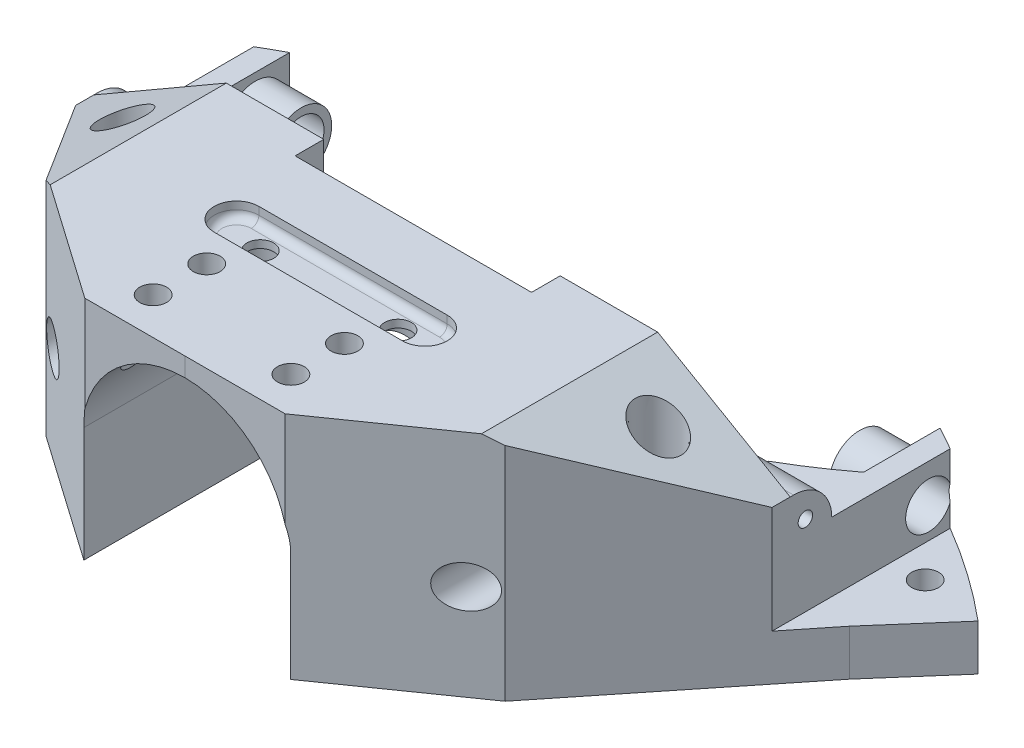
from build123d import *

# Parameters (mm, degrees)
SKETCH1_R                     = 90
BOSS_EXTRUDE1_DEPTH           = 30
CUT_EXTRUDE2_DEPTH            = 131.766968306
SKETCH9_R                     = 1.75
CUT_EXTRUDE7_DEPTH            = 131.766968306
CUT_EXTRUDE8_DEPTH            = 131.766968306
CUT_EXTRUDE8_DEPTH_BACK       = 131.766968306
SKETCH13_R                    = 4
SKETCH13_R_2                  = 3
BOSS_EXTRUDE2_DEPTH           = 6
CUT_EXTRUDE11_START           = -24
CUT_EXTRUDE11_DEPTH           = 127.647932232
SKETCH15_R                    = 3
CUT_EXTRUDE12_DEPTH           = 132.36713529
CUT_EXTRUDE13_DEPTH           = 72.647522697
SKETCH17_R                    = 2.722832204
CUT_EXTRUDE14_DEPTH           = 72.647522697
SKETCH20_W                    = 135.941918887
SKETCH20_H                    = 33.955270407
CUT_EXTRUDE16_DEPTH           = 10
SKETCH21_R                    = 3
CUT_EXTRUDE17_DEPTH           = 102.811580994
SKETCH22_R                    = 1.75
CUT_EXTRUDE18_DEPTH           = 102.811580994
SKETCH23_W                    = 128.45000869
SKETCH23_H                    = 24.409126769
CUT_EXTRUDE19_DEPTH           = 5
FILLET3_R                     = 5
CUT_EXTRUDE20_DEPTH           = 87.014234235
LPATTERN1_COUNT               = 3
LPATTERN1_PITCH               = 7
SKETCH25_R                    = 0.942506241
CUT_EXTRUDE22_DEPTH           = 134.672093131
CUT_EXTRUDE23_DEPTH           = 2
FILLET4_R                     = 1
SKETCH28_W                    = 30.89377208
SKETCH28_H                    = 80.987282378
CUT_EXTRUDE24_DEPTH           = 72.647522738
CHAMFER3_SIZE                 = 10
CHAMFER3_SIZE2                = 17.320508076
CHAMFER2_SIZE                 = 10
CHAMFER2_SIZE2                = 17.320508076
SKETCH29_R                    = 3
CUT_EXTRUDE37_DEPTH           = 25
CUT_EXTRUDE37_DRAFT           = -0.1
CUT_EXTRUDE37_PROFILE_2_DEPTH = 25
CUT_EXTRUDE37_PROFILE_2_DRAFT = -0.1
SKETCH30_R                    = 1.75
CUT_EXTRUDE38_DEPTH           = 102.299546021


with BuildPart() as part:
    # Sketch1 → Boss-Extrude1 (new body)
    with BuildSketch(Plane(origin=(0, 0, 0), x_dir=(1, 0, 0), z_dir=(0, 1, 0))):
        with Locations(Location((0, 0, 0), (0, 0, 270))):
            Circle(SKETCH1_R)
    extrude(amount=BOSS_EXTRUDE1_DEPTH)

    # Sketch4 → Cut-Extrude2 (cut, through all)
    with BuildSketch(Plane(origin=(0, 30, 0), x_dir=(1, 0, 0), z_dir=(0, 1, 0))):
        with BuildLine():
            Line((-42.5, 79.333158263), (-42.5, 69.333158263))
            ThreePointArc((-42.5, 69.333158263), (0, 55), (42.5, 69.333158263))
            Line((42.5, 69.333158263), (42.5, 79.333158263))
            Line((42.5, 79.333158263), (42.5, 105.809765059))
            Line((42.5, 105.809765059), (-42.5, 105.809765059))
            Line((-42.5, 105.809765059), (-42.5, 79.333158263))
        make_face()
    extrude(amount=-CUT_EXTRUDE2_DEPTH, mode=Mode.SUBTRACT)

    # Sketch9 → Cut-Extrude7 (cut, through all)
    with BuildSketch(Plane(origin=(0, 30, 0), x_dir=(1, 0, 0), z_dir=(0, 1, 0))):
        with Locations(Location((-49.706440821, 70.180266036, 0), (0, 0, 270))):
            Circle(SKETCH9_R)
    cut_extrude7 = extrude(amount=-CUT_EXTRUDE7_DEPTH, mode=Mode.SUBTRACT)

    # Mirror1: Cut-Extrude7 across plane
    add(cut_extrude7.mirror(Plane(origin=(0, 0, 0), x_dir=(0, 0, 1), z_dir=(1, 0, 0))), mode=Mode.SUBTRACT)

    # Sketch10 → Cut-Extrude8 (cut, two sides: drawn at the far end of the back side and taken through both)
    with BuildSketch(Plane.XZ.offset(-CUT_EXTRUDE8_DEPTH_BACK)):
        Polygon((349.590781265, -403.844847198), (57.81736756, -68.972110366), (50, -60), (30, -35), (13.088480638, -23.15842666), (0, -23.15842666), (-13.088480638, -23.15842666), (-30, -35), (-50, -60), (-57.81736756, -68.972110366), (-349.590781265, -403.844847198), (-349.590781265, 484.460223862), (349.590781265, 484.460223862), align=None)
    extrude(amount=CUT_EXTRUDE8_DEPTH + CUT_EXTRUDE8_DEPTH_BACK, mode=Mode.SUBTRACT)

    # Sketch13 → Boss-Extrude2 (add)
    with BuildSketch(Plane.ZY.offset(-42.5)):
        with Locations(Location((-74.833158263, 10, 0), (0, 0, 180))):
            Circle(SKETCH13_R)
        with Locations((-74.833158263, 10)):
            Circle(SKETCH13_R_2, mode=Mode.SUBTRACT)
    boss_extrude2 = extrude(amount=BOSS_EXTRUDE2_DEPTH)

    # Sketch14 → Cut-Extrude11 (cut)
    with BuildSketch(Plane(origin=(0, 30, 0), x_dir=(1, 0, 0), z_dir=(0, 1, 0)).offset(CUT_EXTRUDE11_START)):
        Polygon((-45.5, 321.266273117), (-45.5, 77.651464893), (-45.5, 54.375), (-45.5, -189.239808225), (-532.729616449, -189.239808225), (-532.729616449, 321.266273117), align=None)
    cut_extrude11 = extrude(amount=CUT_EXTRUDE11_DEPTH, mode=Mode.SUBTRACT)

    # Sketch15 → Cut-Extrude12 (cut, through all)
    with BuildSketch(Plane.ZY.offset(-42.5)):
        with Locations((-74.833158263, 10)):
            Circle(SKETCH15_R)
    cut_extrude12 = extrude(amount=-CUT_EXTRUDE12_DEPTH, mode=Mode.SUBTRACT)

    # Mirror2: Boss-Extrude2, Cut-Extrude11, Cut-Extrude12 across plane
    add(boss_extrude2.mirror(Plane(origin=(0, 0, 0), x_dir=(0, 0, 1), z_dir=(1, 0, 0))))
    add(cut_extrude11.mirror(Plane(origin=(0, 0, 0), x_dir=(0, 0, 1), z_dir=(1, 0, 0))), mode=Mode.SUBTRACT)
    add(cut_extrude12.mirror(Plane(origin=(0, 0, 0), x_dir=(0, 0, 1), z_dir=(1, 0, 0))), mode=Mode.SUBTRACT)

    # Sketch16 → Cut-Extrude13 (cut, through all)
    with BuildSketch(Plane.XY.offset(-53)):
        with BuildLine():
            Line((33, 19.5), (-33, 19.5))
            ThreePointArc((-33, 19.5), (-34.414213562, 18.914213562), (-35, 17.5))
            Line((-35, 17.5), (-35, 7.5))
            ThreePointArc((-35, 7.5), (-34.414213562, 6.085786438), (-33, 5.5))
            Line((-33, 5.5), (33, 5.5))
            ThreePointArc((33, 5.5), (34.414213562, 6.085786438), (35, 7.5))
            Line((35, 7.5), (35, 17.5))
            ThreePointArc((35, 17.5), (34.414213562, 18.914213562), (33, 19.5))
        make_face()
    extrude(amount=-CUT_EXTRUDE13_DEPTH, mode=Mode.SUBTRACT)

    # Sketch17 → Cut-Extrude14 (cut, through all)
    with BuildSketch(Plane(origin=(0, 0, -53), x_dir=(-1, 0, 0), z_dir=(0, 0, -1))):
        with Locations((-27, 12.5)):
            Circle(SKETCH17_R)
    cut_extrude14 = extrude(amount=-CUT_EXTRUDE14_DEPTH, mode=Mode.SUBTRACT)

    # Mirror3: Cut-Extrude14 across plane
    add(cut_extrude14.mirror(Plane(origin=(0, 0, 0), x_dir=(0, 0, 1), z_dir=(1, 0, 0))), mode=Mode.SUBTRACT)

    # Sketch20 → Cut-Extrude16 (cut)
    with BuildSketch(Plane(origin=(0, 30, 0), x_dir=(1, 0, 0), z_dir=(0, 1, 0))):
        with Locations((4.048048251, 73.72128392)):
            Rectangle(SKETCH20_W, SKETCH20_H)
    extrude(amount=-CUT_EXTRUDE16_DEPTH, mode=Mode.SUBTRACT)

    # Sketch21 → Cut-Extrude17 (cut, through all)
    with BuildSketch(Plane(origin=(0, 27, 0), x_dir=(1, 0, 0), z_dir=(0, 1, 0))):
        with Locations(Location((-9, 42, 0), (0, 0, 270))):
            Circle(SKETCH21_R)
        with Locations(Location((9, 42, 0), (0, 0, 270))):
            Circle(SKETCH21_R)
    cut_extrude17 = extrude(amount=-CUT_EXTRUDE17_DEPTH, mode=Mode.SUBTRACT)

    # Sketch22 → Cut-Extrude18 (cut, through all)
    with BuildSketch(Plane.XZ.offset(-27)):
        with Locations(Location((-9, -42, 0), (0, 0, 270))):
            Circle(SKETCH22_R)
        with Locations(Location((9, -42, 0), (0, 0, 270))):
            Circle(SKETCH22_R)
    cut_extrude18 = extrude(amount=-CUT_EXTRUDE18_DEPTH, mode=Mode.SUBTRACT)

    # Sketch23 → Cut-Extrude19 (cut)
    with BuildSketch(Plane(origin=(0, 20, 0), x_dir=(1, 0, 0), z_dir=(0, 1, 0))):
        with Locations((0.302093153, 74.385888858)):
            Rectangle(SKETCH23_W, SKETCH23_H)
    extrude(amount=-CUT_EXTRUDE19_DEPTH, mode=Mode.SUBTRACT)

    # Fillet3
    fillet3_edges = [part.edges().sort_by_distance(p)[0] for p in [
        (-38.212397598, 20, -62.181325473),
        (38.212397598, 20, -62.181325473),
    ]]
    fillet(fillet3_edges, radius=FILLET3_R - 0.0001)  # a hair under: the kernel refuses the full size

    # Sketch11 → Cut-Extrude20 (cut, through all)
    with BuildSketch(Plane.XY.offset(-23.15842666)):
        with BuildLine():
            Line((-13.5, 15), (-13.5, 0))
            Line((-13.5, 0), (13.5, 0))
            Line((13.5, 0), (13.5, 15))
            ThreePointArc((13.5, 15), (0, 27.536986371), (-13.5, 15))
        make_face()
    extrude(amount=-CUT_EXTRUDE20_DEPTH, mode=Mode.SUBTRACT)

    # LPattern1: Cut-Extrude17, Cut-Extrude18 ×3
    with Locations(*[(0, 0, i * LPATTERN1_PITCH) for i in range(1, LPATTERN1_COUNT)]):
        add(cut_extrude17, mode=Mode.SUBTRACT)
        add(cut_extrude18, mode=Mode.SUBTRACT)

    # Sketch25 → Cut-Extrude22 (cut, through all)
    with BuildSketch(Plane.ZY.offset(45.5)):
        with Locations((-58.733447517, 16.50246845)):
            Circle(SKETCH25_R)
    extrude(amount=-CUT_EXTRUDE22_DEPTH, mode=Mode.SUBTRACT)

    # Sketch26 → Cut-Extrude23 (cut)
    with BuildSketch(Plane(origin=(0, 30, 0), x_dir=(1, 0, 0), z_dir=(0, 1, 0))):
        with BuildLine():
            Line((-12.101973921, 44.919746389), (12.510395296, 44.919746389))
            ThreePointArc((12.510395296, 44.919746389), (15.430141684, 42), (12.510395296, 39.080253611))
            Line((12.510395296, 39.080253611), (-12.101973921, 39.080253611))
            ThreePointArc((-12.101973921, 39.080253611), (-15.02172031, 42), (-12.101973921, 44.919746389))
        make_face()
    extrude(amount=-CUT_EXTRUDE23_DEPTH, mode=Mode.SUBTRACT)

    # Fillet4
    fillet4_edges = [part.edges().sort_by_distance(p)[0] for p in [
        (-15.02172031, 28, -42),
        (0.204210687, 28, -44.919746389),
        (15.430141684, 28, -42),
        (0.204210687, 28, -39.080253611),
    ]]
    fillet(fillet4_edges, radius=FILLET4_R)

    # Sketch28 → Cut-Extrude24 (cut, through all)
    with BuildSketch(Plane.XY.offset(-53)):
        Rectangle(SKETCH28_W, SKETCH28_H)
    extrude(amount=-CUT_EXTRUDE24_DEPTH, mode=Mode.SUBTRACT)

    # Chamfer3
    chamfer3_edges = [part.edges().sort_by_distance(p)[0] for p in [
        (45.5, 30, -55.559324359),
    ]]
    chamfer3_side = [part.faces().sort_by_distance(p)[0] for p in [
        (45.5, 12.910578356, -62.839417811),
    ]]
    chamfer(chamfer3_edges, length=CHAMFER3_SIZE, length2=CHAMFER3_SIZE2, reference=chamfer3_side[0])

    # Chamfer2
    chamfer2_edges = [part.edges().sort_by_distance(p)[0] for p in [
        (-45.5, 30, -55.559324359),
    ]]
    chamfer2_side = [part.faces().sort_by_distance(p)[0] for p in [
        (-45.5, 12.910578356, -62.839417811),
    ]]
    chamfer(chamfer2_edges, length=CHAMFER2_SIZE, length2=CHAMFER2_SIZE2, reference=chamfer2_side[0])


with BuildPart() as cut_extrude37_tool:
    # Sketch29 → Cut-Extrude37 (with draft: the straight prism first)
    with BuildSketch(Plane(origin=(0, 30, 0), x_dir=(1, 0, 0), z_dir=(0, 1, 0))):
        with Locations((-35, 50)):
            Circle(SKETCH29_R)
    extrude(amount=-CUT_EXTRUDE37_DEPTH)
    # Cut-Extrude37: the draft: its side faces are tilted about the plane it starts from
    cut_extrude37_sides = [cut_extrude37_tool.faces().sort_by_distance(p)[0] for p in [
        (-38, 17.5, -50),
    ]]
    draft(cut_extrude37_sides, Plane(origin=(0, 30, 0), x_dir=(1, 0, 0), z_dir=(0, 1, 0)), CUT_EXTRUDE37_DRAFT)


with BuildPart() as part_1:
    add(part.part)

    # Cut-Extrude37: cut by cut_extrude37_tool
    add(cut_extrude37_tool.part, mode=Mode.SUBTRACT)


with BuildPart() as cut_extrude37_profile_2_tool:
    # Sketch29 → Cut-Extrude37 profile 2 (with draft: the straight prism first)
    with BuildSketch(Plane(origin=(0, 30, 0), x_dir=(1, 0, 0), z_dir=(0, 1, 0))):
        with Locations((35, 50)):
            Circle(SKETCH29_R)
    extrude(amount=-CUT_EXTRUDE37_PROFILE_2_DEPTH)
    # Cut-Extrude37 profile 2: the draft: its side faces are tilted about the plane it starts from
    cut_extrude37_profile_2_sides = [cut_extrude37_profile_2_tool.faces().sort_by_distance(p)[0] for p in [
        (32, 17.5, -50),
    ]]
    draft(cut_extrude37_profile_2_sides, Plane(origin=(0, 30, 0), x_dir=(1, 0, 0), z_dir=(0, 1, 0)), CUT_EXTRUDE37_PROFILE_2_DRAFT)


with BuildPart() as part_2:
    add(part_1.part)

    # Cut-Extrude37 profile 2: cut by cut_extrude37_profile_2_tool
    add(cut_extrude37_profile_2_tool.part, mode=Mode.SUBTRACT)

    # Sketch30 → Cut-Extrude38 (cut, through all)
    with BuildSketch(Plane(origin=(0, 5, 0), x_dir=(1, 0, 0), z_dir=(0, 1, 0))):
        with Locations(Location((-35, 50, 0), (0, 0, 270))):
            Circle(SKETCH30_R)
        with Locations(Location((35, 50, 0), (0, 0, 270))):
            Circle(SKETCH30_R)
    extrude(amount=-CUT_EXTRUDE38_DEPTH, mode=Mode.SUBTRACT)


solid = part_2.part
